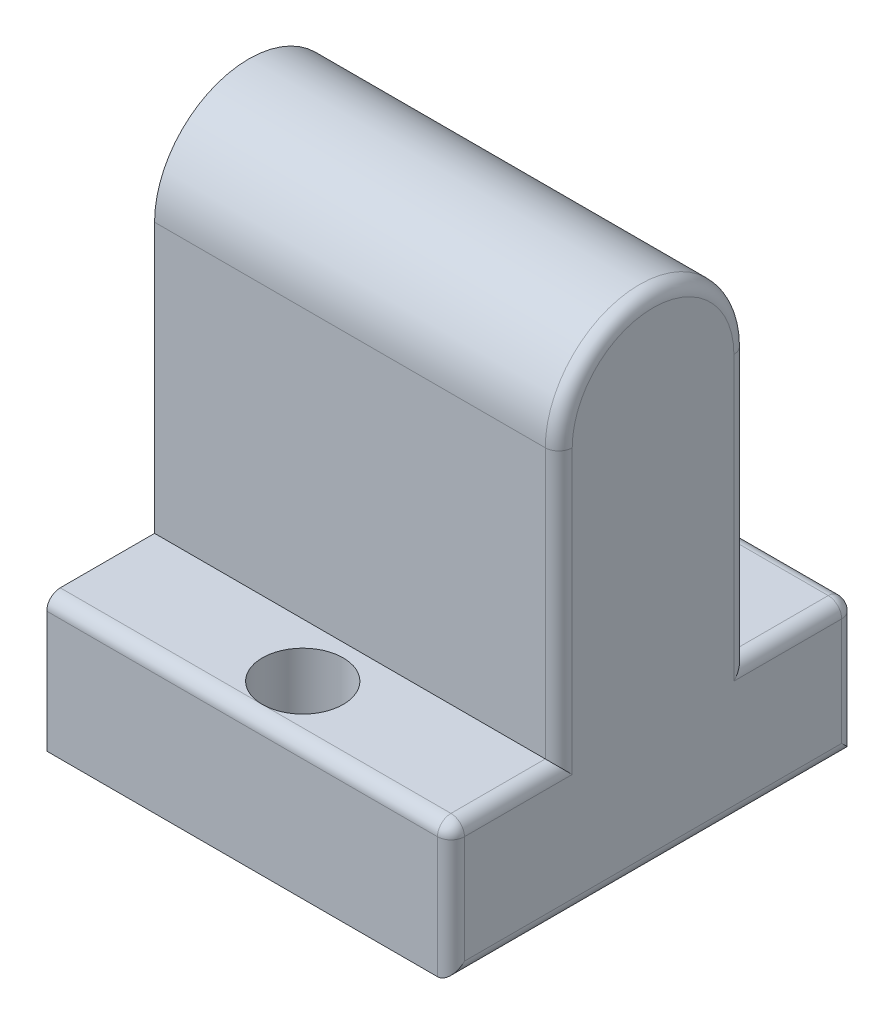
from build123d import *

# Parameters (mm, degrees)
SKETCH1_R           = 4
BOSS_EXTRUDE3_DEPTH = 30
SKETCH3_W           = 30.000000000000004
SKETCH3_H           = 30
BOSS_EXTRUDE4_DEPTH = 10
SKETCH4_R           = 3.0000000000000004
CUT_EXTRUDE1_DEPTH  = 10
BOSS_EXTRUDE5_START = -5
SKETCH5_R           = 4
BOSS_EXTRUDE5_DEPTH = 5
FILLET2_R           = 1


with BuildPart() as part:
    # Sketch1 → Boss-Extrude3 (new body)
    with BuildSketch(Plane(origin=(0, 0, 0), x_dir=(0, 0, -1), z_dir=(1, 0, 0))):
        with BuildLine():
            Line((-6.999999999999999, 0), (-6.9999999999999964, -20))
            Line((-6.9999999999999964, -20), (6.9999999999999964, -20))
            Line((6.9999999999999964, -20), (6.999999999999999, 0))
            ThreePointArc((6.999999999999999, 0), (4.3e-16, 6.999999999999999), (-6.999999999999999, 0))
        make_face()
        Circle(SKETCH1_R, mode=Mode.SUBTRACT)
    extrude(amount=BOSS_EXTRUDE3_DEPTH)

    # Sketch3 → Boss-Extrude4 (add)
    with BuildSketch(Plane.XZ.offset(20)):
        with Locations((15.000000000000002, 1.78e-15)):
            Rectangle(SKETCH3_W, SKETCH3_H)
    extrude(amount=BOSS_EXTRUDE4_DEPTH)

    # Sketch4 → Cut-Extrude1 (cut)
    with BuildSketch(Plane(origin=(0, -20, 0), x_dir=(1, 0, 0), z_dir=(0, 1, 0))):
        with Locations((15, 10.999999999999996)):
            Circle(SKETCH4_R)
        with Locations((15, -11)):
            Circle(SKETCH4_R)
    extrude(amount=-CUT_EXTRUDE1_DEPTH, mode=Mode.SUBTRACT)

    # Sketch5 → Boss-Extrude5 (add)
    with BuildSketch(Plane(origin=(30, 0, 0), x_dir=(0, 0, -1), z_dir=(1, 0, 0)).offset(BOSS_EXTRUDE5_START)):
        Circle(SKETCH5_R)
    extrude(amount=BOSS_EXTRUDE5_DEPTH)

    # Fillet2
    fillet2_edges = [part.edges().sort_by_distance(p)[0] for p in [
        (30, -10, -6.999999999999998),
        (30, -20, -10.999999999999996),
        (30, -25, -14.999999999999998),
        (30, -30, 1.78e-15),
        (30, -25, 15.000000000000002),
        (30, -20, 10.999999999999998),
        (30, -10, 6.999999999999998),
        (30, 6.999999999999999, -1.09e-15),
        (15, -20, -14.999999999999998),
        (15, -20, 15.000000000000002),
    ]]
    fillet(fillet2_edges, radius=FILLET2_R)


solid = part.part
